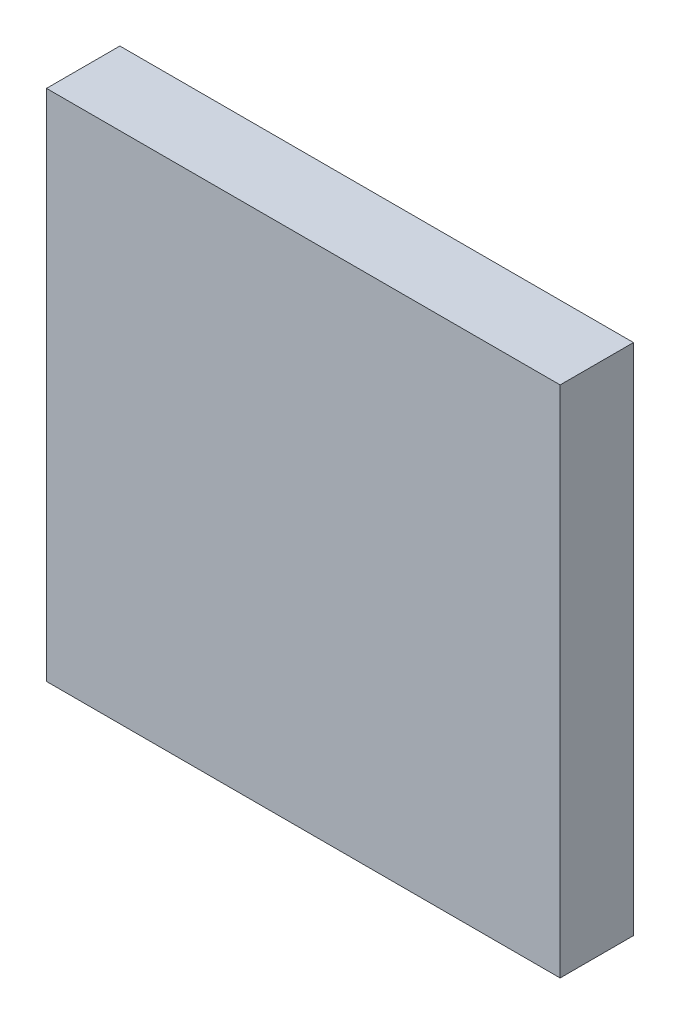
from build123d import *

# Parameters (mm, degrees)
SKETCH1_W      = 35
SKETCH1_H      = 35
MIRROR_2_DEPTH = 5


with BuildPart() as part:
    # Sketch1 → Mirror 2 (new body)
    with BuildSketch(Plane.XY):
        Rectangle(SKETCH1_W, SKETCH1_H)
    extrude(amount=MIRROR_2_DEPTH)


solid = part.part
